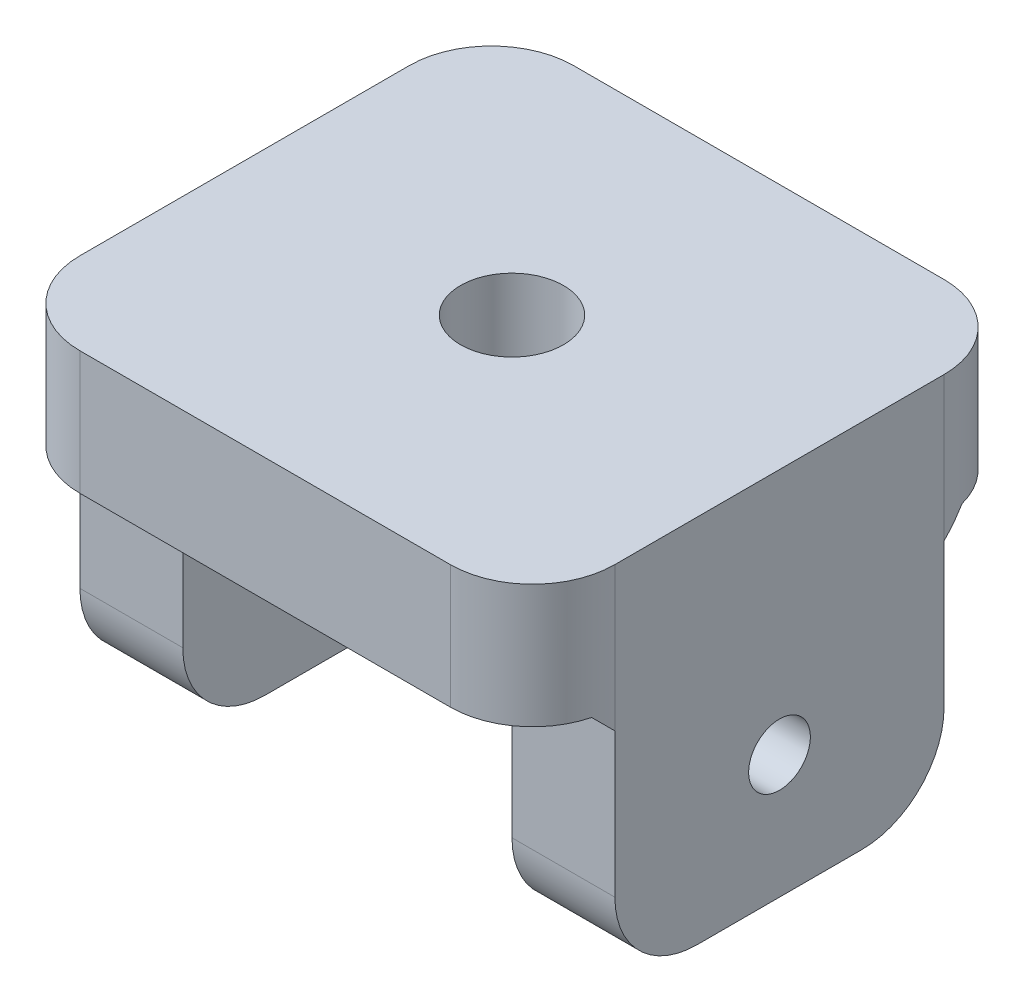
from build123d import *

# Parameters (mm, degrees)
SKETCH_1_W          = 26
SKETCH_1_H          = 24
EXTRUDE_1_DEPTH     = 6
SKETCH_2_W          = 5
SKETCH_2_H          = 16
EXTRUDE_2_DEPTH     = 12
SKETCH_3_R          = 1.5
CUT_EXTRUDE_1_DEPTH = 80
SKETCH_4_R          = 2.5
CUT_EXTRUDE_2_DEPTH = 3.75
FILLET_1_R          = 4
FILLET_2_R          = 4
CHAMFER_1_SIZE      = 1


with BuildPart() as part:
    # 草图1 → 凸台-拉伸1 (new body)
    with BuildSketch(Plane(origin=(0, 0, 0), x_dir=(1, 0, 0), z_dir=(0, 1, 0))):
        with Locations((-13, 12)):
            Rectangle(SKETCH_1_W, SKETCH_1_H)
    extrude(amount=EXTRUDE_1_DEPTH)

    # 草图2 → 凸台-拉伸2 (add)
    with BuildSketch(Plane.XZ):
        with Locations((-23.5, -12)):
            Rectangle(SKETCH_2_W, SKETCH_2_H)
        with Locations((-2.5, -12)):
            Rectangle(SKETCH_2_W, SKETCH_2_H)
    extrude(amount=EXTRUDE_2_DEPTH)

    # 草图3 → 切除-拉伸1 (cut)
    with BuildSketch(Plane.ZY.offset(26)):
        with Locations((-12, -6)):
            Circle(SKETCH_3_R)
    extrude(amount=-CUT_EXTRUDE_1_DEPTH, mode=Mode.SUBTRACT)

    # 草图4 → 切除-拉伸2 (cut)
    with BuildSketch(Plane(origin=(0, 6, 0), x_dir=(1, 0, 0), z_dir=(0, 1, 0))):
        with Locations(Location((-13, 12, 0), (0, 0, 270))):
            Circle(SKETCH_4_R)
    extrude(amount=-CUT_EXTRUDE_2_DEPTH, mode=Mode.SUBTRACT)

    # 圆角1
    fillet_1_edges = [part.edges().sort_by_distance(p)[0] for p in [
        (-26, 3, -24),
        (0, 3, -24),
        (0, 3, 0),
        (-26, 3, 0),
    ]]
    fillet(fillet_1_edges, radius=FILLET_1_R)

    # 圆角2
    fillet_2_edges = [part.edges().sort_by_distance(p)[0] for p in [
        (-23.5, -12, -20),
        (-23.5, -12, -4),
        (-2.5, -12, -4),
        (-2.5, -12, -20),
    ]]
    fillet(fillet_2_edges, radius=FILLET_2_R)

    # 倒角1
    # the kernel refuses this chamfer: 1 mm, written as the material it adds along each edge
    with BuildSketch(Plane(origin=(-21, 0, -20), x_dir=(0, -0.9996219169112968, 0.02749587661058563), z_dir=(-1, 0, 0))) as chamfer_1_piece_1_section:
        Polygon((CHAMFER_1_SIZE * 0.999621916911, -CHAMFER_1_SIZE * 0.0274958766106), (-CHAMFER_1_SIZE * 0.0274958766106, -CHAMFER_1_SIZE * 0.999621916911), (0, 0), align=None)
    chamfer_1_piece_1 = extrude(amount=7.571682988, mode=Mode.PRIVATE)
    chamfer_1_piece_1 = chamfer_1_piece_1 & Plane(origin=(-22, -0.333896309, -20), x_dir=(-1, 0, 0), z_dir=(0, 1, 0)) * Cylinder(4, 20, mode=Mode.PRIVATE)
    add(chamfer_1_piece_1)
    with BuildSketch(Plane(origin=(-28.571682988, 0, -4), x_dir=(0, 0.02749587661058636, 0.9996219169112968), z_dir=(1, 0, 0))) as chamfer_1_piece_2_section:
        Polygon((CHAMFER_1_SIZE * 0.999621916911, CHAMFER_1_SIZE * 0.0274958766106), (-CHAMFER_1_SIZE * 0.0274958766106, CHAMFER_1_SIZE * 0.999621916911), (0, 0), align=None)
    chamfer_1_piece_2 = extrude(amount=7.571682988, mode=Mode.PRIVATE)
    chamfer_1_piece_2 = chamfer_1_piece_2 & Plane(origin=(-22, -0.333896309, -4), x_dir=(0, 0, 1), z_dir=(0, 1, 0)) * Cylinder(4, 20, mode=Mode.PRIVATE)
    add(chamfer_1_piece_2)
    with BuildSketch(Plane(origin=(2.571682988, 0, -4), x_dir=(0, 0.02749587661058636, 0.9996219169112968), z_dir=(-1, 0, 0))) as chamfer_1_piece_3_section:
        Polygon((CHAMFER_1_SIZE * 0.999621916911, -CHAMFER_1_SIZE * 0.0274958766106), (-CHAMFER_1_SIZE * 0.0274958766106, -CHAMFER_1_SIZE * 0.999621916911), (0, 0), align=None)
    chamfer_1_piece_3 = extrude(amount=7.571682988, mode=Mode.PRIVATE)
    chamfer_1_piece_3 = chamfer_1_piece_3 & Plane(origin=(-4, -0.333896309, -4), x_dir=(0, 0, 1), z_dir=(0, 1, 0)) * Cylinder(4, 20, mode=Mode.PRIVATE)
    add(chamfer_1_piece_3)
    with BuildSketch(Plane(origin=(-5, 0, -20), x_dir=(0, 0.02749587661058639, -0.9996219169112968), z_dir=(1, 0, 0))) as chamfer_1_piece_4_section:
        Polygon((CHAMFER_1_SIZE * 0.999621916911, -CHAMFER_1_SIZE * 0.0274958766106), (-CHAMFER_1_SIZE * 0.0274958766106, -CHAMFER_1_SIZE * 0.999621916911), (0, 0), align=None)
    chamfer_1_piece_4 = extrude(amount=7.571682988, mode=Mode.PRIVATE)
    chamfer_1_piece_4 = chamfer_1_piece_4 & Plane(origin=(-4, -0.333896309, -20), x_dir=(1, 0, 0), z_dir=(0, 1, 0)) * Cylinder(4, 20, mode=Mode.PRIVATE)
    add(chamfer_1_piece_4)


solid = part.part
